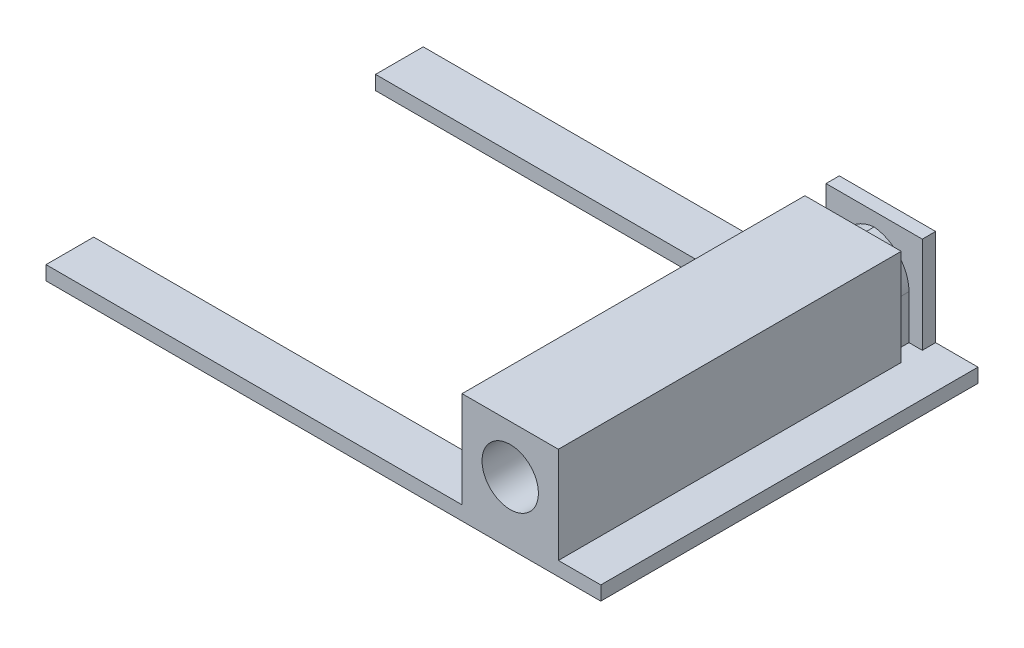
from build123d import *

# Parameters (mm, degrees)
BOSS_EXTRUDE1_DEPTH = 12.7
SKETCH4_W           = 86.8
SKETCH4_H           = 86.8
SKETCH4_R           = 25.4
BOSS_EXTRUDE3_DEPTH = 340
SKETCH6_W           = 86.8
SKETCH6_H           = 19
CUT_EXTRUDE3_DEPTH  = 12
SKETCH7_W           = 19
SKETCH7_H           = 74.8
CUT_EXTRUDE4_DEPTH  = 12
SKETCH8_W           = 19
SKETCH8_H           = 74.8
CUT_EXTRUDE5_DEPTH  = 12
FILLET2_R           = 35


with BuildPart() as part:
    # Sketch1 → Boss-Extrude1 (new body)
    with BuildSketch(Plane(origin=(0, 0, 0), x_dir=(1, 0, 0), z_dir=(0, 1, 0))):
        Polygon((-367.746211961, 196.825353899), (132.253788039, 196.825353899), (132.253788039, -143.174646101), (-367.746211961, -143.174646101), (-367.746211961, -100.174646101), (7.253788039, -100.174646101), (7.253788039, 153.825353899), (-367.746211961, 153.825353899), align=None)
    extrude(amount=BOSS_EXTRUDE1_DEPTH)

    # Sketch4 → Boss-Extrude3 (add)
    with BuildSketch(Plane.XY.offset(143.174646101)):
        with Locations((50.653788039, 56.1)):
            Rectangle(SKETCH4_W, SKETCH4_H)
        with Locations((50.653788039, 56.1)):
            Circle(SKETCH4_R, mode=Mode.SUBTRACT)
    extrude(amount=-BOSS_EXTRUDE3_DEPTH)

    # Sketch6 → Cut-Extrude3 (cut)
    with BuildSketch(Plane(origin=(0, 99.5, 0), x_dir=(1, 0, 0), z_dir=(0, 1, 0))):
        with Locations((50.653788039, 175.325353899)):
            Rectangle(SKETCH6_W, SKETCH6_H)
    extrude(amount=-CUT_EXTRUDE3_DEPTH, mode=Mode.SUBTRACT)

    # Sketch7 → Cut-Extrude4 (cut)
    with BuildSketch(Plane.ZY.offset(-7.253788039)):
        with Locations((-175.325353899, 50.1)):
            Rectangle(SKETCH7_W, SKETCH7_H)
    extrude(amount=-CUT_EXTRUDE4_DEPTH, mode=Mode.SUBTRACT)

    # Sketch8 → Cut-Extrude5 (cut)
    with BuildSketch(Plane(origin=(94.053788039, 0, 0), x_dir=(0, 0, -1), z_dir=(1, 0, 0))):
        with Locations((175.325353899, 50.1)):
            Rectangle(SKETCH8_W, SKETCH8_H)
    extrude(amount=-CUT_EXTRUDE5_DEPTH, mode=Mode.SUBTRACT)

    # Fillet2
    # the kernel refuses this fillet: 35 mm, written as the material it takes off along each edge
    with BuildSketch(Plane(origin=(82.053788039, 87.5, -165.825353899), x_dir=(-1, 0, 0), z_dir=(0, 0, -1))) as fillet2_piece_1:
        with BuildLine():
            CenterArc((FILLET2_R, -FILLET2_R), FILLET2_R, 90, 90)
            Line((0, -FILLET2_R), (0, 0))
            Line((0, 0), (FILLET2_R, 0))
        make_face()
    extrude(amount=19, mode=Mode.SUBTRACT)
    with BuildSketch(Plane(origin=(19.253788039, 87.5, -184.825353899), x_dir=(0, -1, 0), z_dir=(0, 0, 1))) as fillet2_piece_2:
        with BuildLine():
            CenterArc((FILLET2_R, FILLET2_R), FILLET2_R, 180, 90)
            Line((0, FILLET2_R), (0, 0))
            Line((0, 0), (FILLET2_R, 0))
        make_face()
    extrude(amount=19, mode=Mode.SUBTRACT)


solid = part.part
